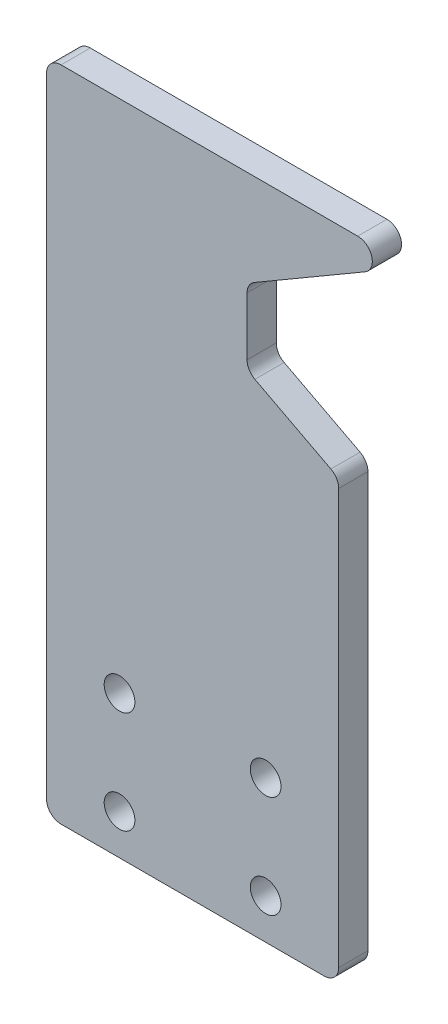
from build123d import *

# Parameters (mm, degrees)
EXTRUDE_1_DEPTH     = 4
CUT_EXTRUDE_1_REACH = 66.971
SKETCH_2_R          = 2.1
FILLET_1_R          = 2


with BuildPart() as part:
    # 草图1 → 凸台-拉伸1 (new body)
    with BuildSketch(Plane.XY):
        with BuildLine():
            Line((22.601645061, 60), (-20, 60))
            Line((-20, 60), (-20, 30))
            Line((-20, 30), (-20, -30))
            Line((-20, -30), (20, -30))
            Line((20, -30), (20, 30))
            Line((20, 30), (7.452886156, 36.550356938))
            Line((7.452886156, 36.550356938), (7.452886156, 46.848574365))
            Line((7.452886156, 46.848574365), (23.60932666, 56.272406935))
            ThreePointArc((23.60932666, 56.272406935), (24.53234262, 58.521926178), (22.601645061, 60))
        make_face()
    extrude(amount=EXTRUDE_1_DEPTH)

    # 草图2 → 切除-拉伸1 (cut, up to next)
    with BuildSketch(Plane.XY.offset(4), mode=Mode.PRIVATE) as cut_extrude_1_sk1:
        with Locations((-10, -24.5)):
            Circle(SKETCH_2_R)
    cut_extrude_1_tool1 = extrude(cut_extrude_1_sk1.sketch, amount=-CUT_EXTRUDE_1_REACH, mode=Mode.PRIVATE) & part.part
    # 草图2 → 切除-拉伸1 (cut, up to next)
    with BuildSketch(Plane.XY.offset(4), mode=Mode.PRIVATE) as cut_extrude_1_sk2:
        with Locations((-10, -10.5)):
            Circle(SKETCH_2_R)
    cut_extrude_1_tool2 = extrude(cut_extrude_1_sk2.sketch, amount=-CUT_EXTRUDE_1_REACH, mode=Mode.PRIVATE) & part.part
    # 草图2 → 切除-拉伸1 (cut, up to next)
    with BuildSketch(Plane.XY.offset(4), mode=Mode.PRIVATE) as cut_extrude_1_sk3:
        with Locations((10, -10.5)):
            Circle(SKETCH_2_R)
    cut_extrude_1_tool3 = extrude(cut_extrude_1_sk3.sketch, amount=-CUT_EXTRUDE_1_REACH, mode=Mode.PRIVATE) & part.part
    # 草图2 → 切除-拉伸1 (cut, up to next)
    with BuildSketch(Plane.XY.offset(4), mode=Mode.PRIVATE) as cut_extrude_1_sk4:
        with Locations((10, -24.5)):
            Circle(SKETCH_2_R)
    cut_extrude_1_tool4 = extrude(cut_extrude_1_sk4.sketch, amount=-CUT_EXTRUDE_1_REACH, mode=Mode.PRIVATE) & part.part
    add(cut_extrude_1_tool1.solids().sort_by_distance((-10, -24.5, 4))[0], mode=Mode.SUBTRACT)
    add(cut_extrude_1_tool2.solids().sort_by_distance((-10, -10.5, 4))[0], mode=Mode.SUBTRACT)
    add(cut_extrude_1_tool3.solids().sort_by_distance((10, -10.5, 4))[0], mode=Mode.SUBTRACT)
    add(cut_extrude_1_tool4.solids().sort_by_distance((10, -24.5, 4))[0], mode=Mode.SUBTRACT)

    # 圆角1
    fillet_1_edges = [part.edges().sort_by_distance(p)[0] for p in [
        (-20, 60, 2),
        (20, 30, 2),
        (20, -30, 2),
        (-20, -30, 2),
        (7.452886156, 46.848574365, 2),
        (7.452886156, 36.550356938, 2),
    ]]
    fillet(fillet_1_edges, radius=FILLET_1_R)


solid = part.part
